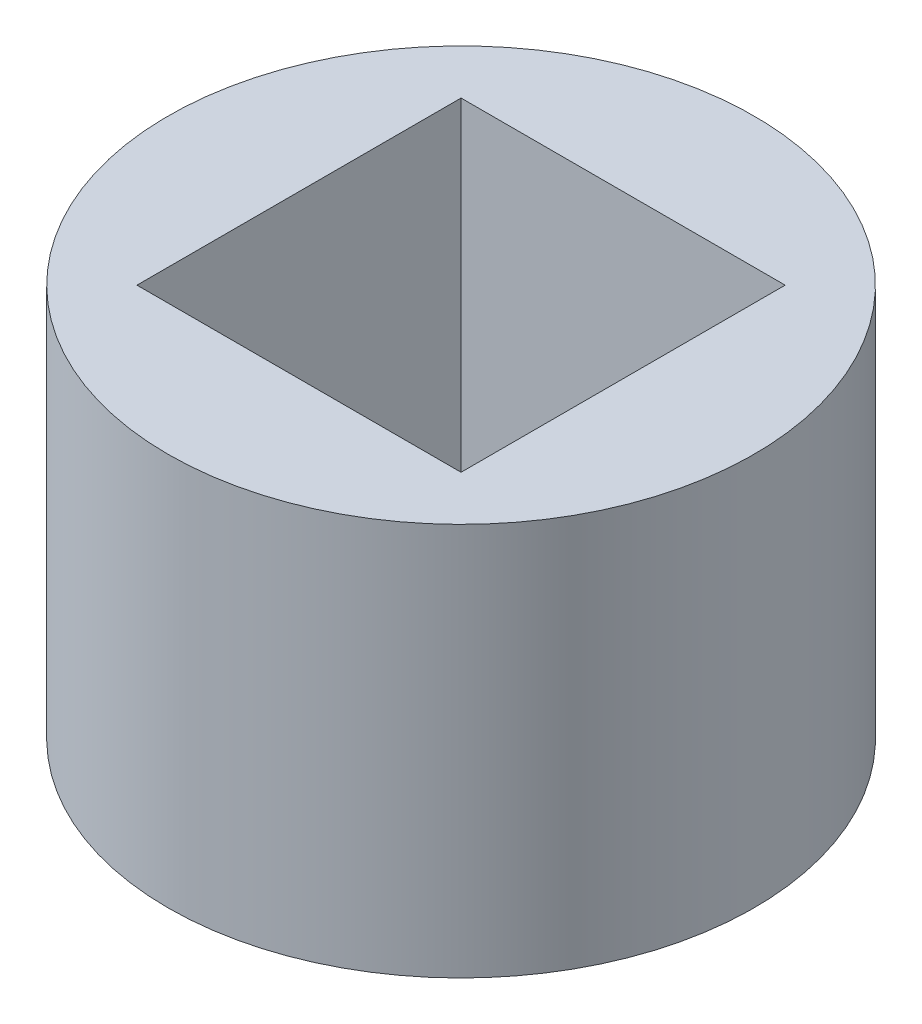
from build123d import *

# Parameters (mm, degrees)
SKETCH1_R           = 8.95
SKETCH1_W           = 9.9
SKETCH1_H           = 9.9
BOSS_EXTRUDE1_DEPTH = 12


with BuildPart() as part:
    # Sketch1 → Boss-Extrude1 (new body)
    with BuildSketch(Plane(origin=(0, 0, 0), x_dir=(1, 0, 0), z_dir=(0, 1, 0))):
        Circle(SKETCH1_R)
        Rectangle(SKETCH1_W, SKETCH1_H, mode=Mode.SUBTRACT)
    extrude(amount=BOSS_EXTRUDE1_DEPTH)


solid = part.part
